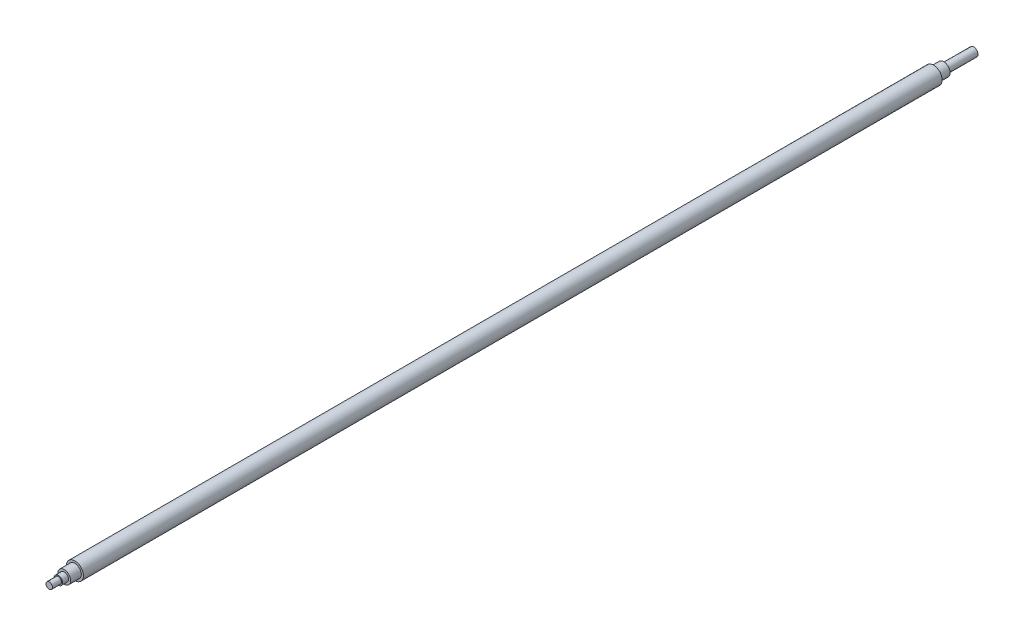
from build123d import *


with BuildPart() as part:
    # Schizzo2 → Rivoluzione2 (revolve)
    with BuildSketch(Plane(origin=(0, 0, 0), x_dir=(0, 0, -1), z_dir=(1, 0, 0))):
        Polygon((0, 0), (0, 3), (8.5, 3), (8.5, 4), (14, 4), (14, 6), (24, 6), (24, 8), (826, 8), (826, 6), (835.5, 6), (835.5, 4), (863.5, 4), (863.5, 0), align=None)
    revolve(axis=Axis((0, 0, 0), (0, 0, -1)))


solid = part.part
